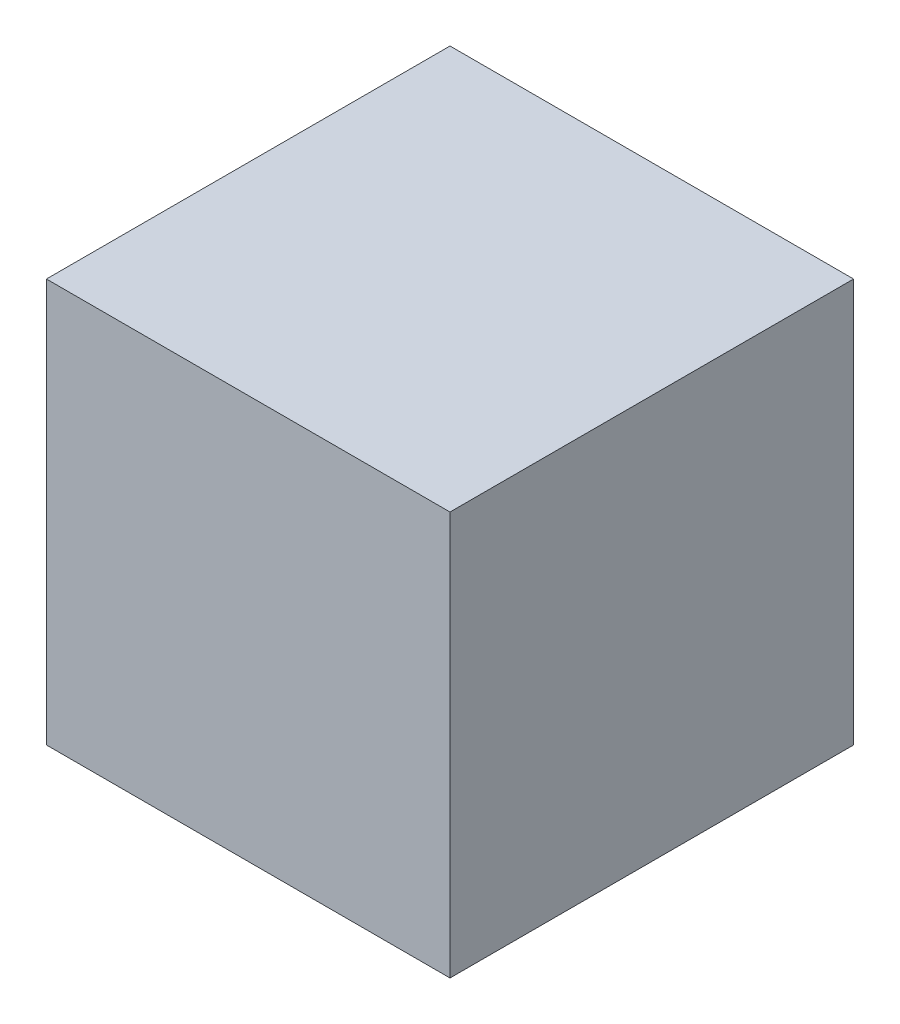
from build123d import *

# Parameters (mm, degrees)
SCHIZZO1_W                   = 100
SCHIZZO1_H                   = 100
ESTRUSIONE_ESTRUSIONE1_DEPTH = 100


with BuildPart() as part:
    # Schizzo1 → Estrusione-Estrusione1 (new body)
    with BuildSketch(Plane.XY):
        Rectangle(SCHIZZO1_W, SCHIZZO1_H)
    extrude(amount=ESTRUSIONE_ESTRUSIONE1_DEPTH)


solid = part.part
